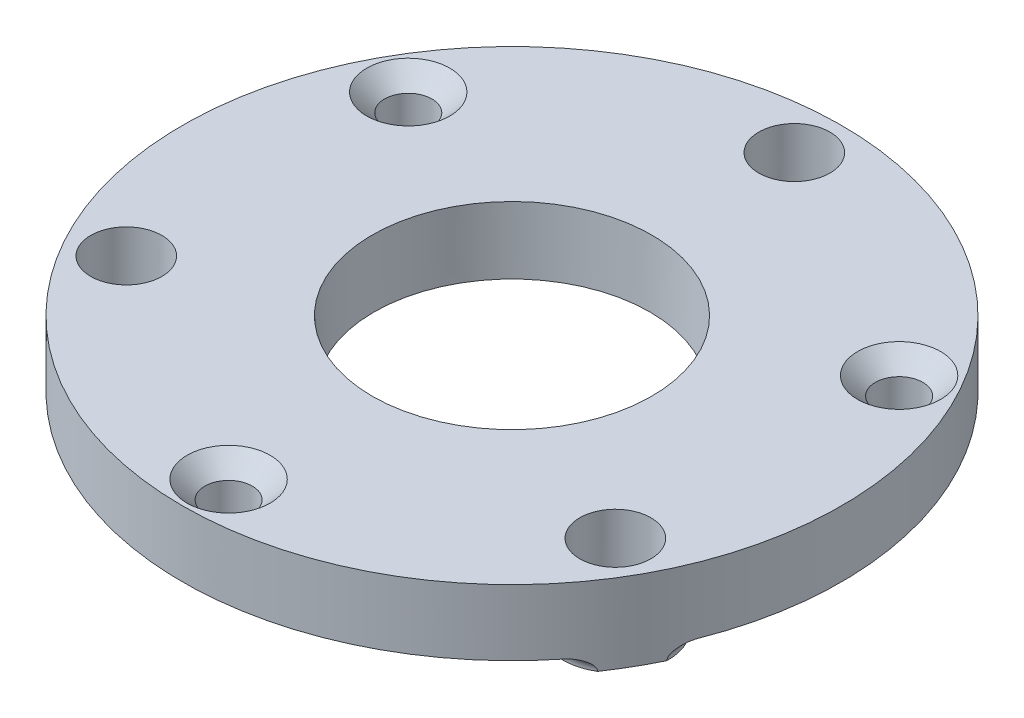
from build123d import *
from build123d.topology import SkipClean

# Parameters (mm, degrees)
CROQUIS1_R                                           = 25
SALIENTE_EXTRUIR1_DEPTH                              = 5
CROQUIS2_R                                           = 2.7
CORTAR_EXTRUIR2_DEPTH                                = 5
CROQUIS3_R                                           = 1.45
CORTAR_EXTRUIR3_DEPTH                                = 5
CROQUIS4_R                                           = 10.6
CORTAR_EXTRUIR4_DEPTH                                = 5
CORTAR_EXTRUIR4_DRAFT                                = -1.5
AVELLANADO_PARA_TORNILLO_CON_CABEZA_PLAN_D           = 3.6
AVELLANADO_PARA_TORNILLO_CON_CABEZA_PLAN_CSINK_D     = 6.3
AVELLANADO_PARA_TORNILLO_CON_CABEZA_PLAN_CSINK_ANGLE = 90
CROQUIS7_R                                           = 2.7
SALIENTE_EXTRUIR2_DEPTH                              = 1
REDONDEO1_R                                          = 1


with BuildPart() as part:
    # Croquis1 → Saliente-Extruir1 (new body)
    with BuildSketch(Plane(origin=(0, 0, 0), x_dir=(1, 0, 0), z_dir=(0, 1, 0))):
        with Locations(Location((0, 0, 0), (0, 0, 270))):
            Circle(CROQUIS1_R)
    extrude(amount=SALIENTE_EXTRUIR1_DEPTH)

    # Croquis2 → Cortar-Extruir2 (cut)
    with BuildSketch(Plane(origin=(0, 5, 0), x_dir=(1, 0, 0), z_dir=(0, 1, 0))):
        with Locations(Location((0, 21.42, 0), (0, 0, 270))):
            Circle(CROQUIS2_R)
        with Locations(Location((18.550264149, -10.71, 0), (0, 0, 270))):
            Circle(CROQUIS2_R)
        with Locations(Location((-18.550264149, -10.71, 0), (0, 0, 270))):
            Circle(CROQUIS2_R)
    extrude(amount=-CORTAR_EXTRUIR2_DEPTH, mode=Mode.SUBTRACT)

    # Croquis3 → Cortar-Extruir3 (cut)
    with BuildSketch(Plane(origin=(0, 5, 0), x_dir=(1, 0, 0), z_dir=(0, 1, 0))):
        with Locations(Location((0, -21.5, 0), (0, 0, 270))):
            Circle(CROQUIS3_R)
        with Locations(Location((-18.619546181, 10.75, 0), (0, 0, 270))):
            Circle(CROQUIS3_R)
        with Locations(Location((18.619546181, 10.75, 0), (0, 0, 270))):
            Circle(CROQUIS3_R)
    extrude(amount=-CORTAR_EXTRUIR3_DEPTH, mode=Mode.SUBTRACT)


with BuildPart() as cortar_extruir4_tool:
    # Croquis4 → Cortar-Extruir4 (with draft: the straight prism first)
    with BuildSketch(Plane(origin=(0, 5, 0), x_dir=(1, 0, 0), z_dir=(0, 1, 0))):
        Circle(CROQUIS4_R)
    extrude(amount=-CORTAR_EXTRUIR4_DEPTH)
    # Cortar-Extruir4: the draft: its side faces are tilted about the plane it starts from
    cortar_extruir4_sides = [cortar_extruir4_tool.faces().sort_by_distance(p)[0] for p in [
        (-10.6, 2.5, 0),
    ]]
    draft(cortar_extruir4_sides, Plane(origin=(0, 5, 0), x_dir=(1, 0, 0), z_dir=(0, 1, 0)), CORTAR_EXTRUIR4_DRAFT)


with BuildPart() as part_1:
    add(part.part)

    # Cortar-Extruir4: cut by cortar_extruir4_tool
    add(cortar_extruir4_tool.part, mode=Mode.SUBTRACT)

    # Avellanado para tornillo con cabeza plana de M31 (through all)
    with Locations(Plane(origin=(0, 5, 0), x_dir=(1, 0, 0), z_dir=(0, 1, 0))):
        with Locations((-18.619546181, 10.75), (18.619546181, 10.75), (0, -21.5)):
            CounterSinkHole(AVELLANADO_PARA_TORNILLO_CON_CABEZA_PLAN_D / 2, AVELLANADO_PARA_TORNILLO_CON_CABEZA_PLAN_CSINK_D / 2, counter_sink_angle=AVELLANADO_PARA_TORNILLO_CON_CABEZA_PLAN_CSINK_ANGLE)

    # Croquis7 → Saliente-Extruir2 (add)
    # profile 1 of 3: a face of its own
    with SkipClean():  # the faces are left unmerged after this step: merging them gives an invalid solid
        with BuildSketch(Plane(origin=(0, 0, 0), x_dir=(-1, 0, 0), z_dir=(0, -1, 0))):
            with BuildLine():
                ThreePointArc((22.549366787, -10.794723595), (15.086162534, -8.71), (20.623188254, -14.13096268))
                ThreePointArc((20.623188254, -14.13096268), (21.650635095, -12.5), (22.549366787, -10.794723595))
            make_face()
            with Locations(Location((18.550264149, -10.71, 0), (0, 0, 270))):
                Circle(CROQUIS7_R, mode=Mode.SUBTRACT)
        # profile 2 of 3: a face of its own
        with BuildSketch(Plane(origin=(0, 0, 0), x_dir=(-1, 0, 0), z_dir=(0, -1, 0))):
            with BuildLine():
                ThreePointArc((-20.623188254, -14.13096268), (-15.086162534, -8.71), (-22.549366787, -10.794723595))
                ThreePointArc((-22.549366787, -10.794723595), (-21.650635095, -12.5), (-20.623188254, -14.13096268))
            make_face()
            with Locations(Location((-18.550264149, -10.71, 0), (0, 0, 270))):
                Circle(CROQUIS7_R, mode=Mode.SUBTRACT)
        # profile 3 of 3: a face of its own
        with BuildSketch(Plane(origin=(0, 0, 0), x_dir=(-1, 0, 0), z_dir=(0, -1, 0))):
            with BuildLine():
                ThreePointArc((-1.926178534, 24.925686275), (0, 17.42), (1.926178534, 24.925686275))
                ThreePointArc((1.926178534, 24.925686275), (0, 25), (-1.926178534, 24.925686275))
            make_face()
            with Locations(Location((0, 21.42, 0), (0, 0, 270))):
                Circle(CROQUIS7_R, mode=Mode.SUBTRACT)
        extrude(amount=SALIENTE_EXTRUIR2_DEPTH)

    # Redondeo1
    # the kernel refuses this fillet: 1 mm, written as the material it adds along each edge
    with BuildSketch(Plane(origin=(0, 0, -21.42), x_dir=(0.0031415874858800596, 0, -0.9999950652018583), z_dir=(-0.9999950652018583, 0, -0.0031415874858800596))) as redondeo1_piece_1_section:
        with BuildLine():
            CenterArc((4 + REDONDEO1_R, REDONDEO1_R), REDONDEO1_R, 180, 90)
            Line((4, REDONDEO1_R), (4, 0))
            Line((4, 0), (4 + REDONDEO1_R, 0))
        make_face()
    redondeo1_piece_1 = revolve(axis=Axis((0, 0, -21.42), (0, -1, 0)), revolution_arc=359.64, mode=Mode.PRIVATE)
    redondeo1_piece_1 = redondeo1_piece_1 & Plane(origin=(0, -0.280437839, 0), x_dir=(0, 0, 1), z_dir=(0, -1, 0)) * Cylinder(25, 21, mode=Mode.PRIVATE)
    add(redondeo1_piece_1)
    with BuildSketch(Plane(origin=(18.550264149, 0, 10.71), x_dir=(0.8644503363809782, 0, 0.5027182271718559), z_dir=(0.5027182271718559, 0, -0.8644503363809782))) as redondeo1_piece_2_section:
        with BuildLine():
            CenterArc((4 + REDONDEO1_R, REDONDEO1_R), REDONDEO1_R, 180, 90)
            Line((4, REDONDEO1_R), (4, 0))
            Line((4, 0), (4 + REDONDEO1_R, 0))
        make_face()
    redondeo1_piece_2 = revolve(axis=Axis((18.550264149, 0, 10.71), (0, -1, 0)), revolution_arc=359.64, mode=Mode.PRIVATE)
    redondeo1_piece_2 = redondeo1_piece_2 & Plane(origin=(0, -0.280437839, 0), x_dir=(0, 0, 1), z_dir=(0, -1, 0)) * Cylinder(25, 21, mode=Mode.PRIVATE)
    add(redondeo1_piece_2)
    with BuildSketch(Plane(origin=(-18.550264149, 0, 10.71), x_dir=(-0.867591923866794, 0, 0.49727683803000045), z_dir=(0.49727683803000045, 0, 0.867591923866794))) as redondeo1_piece_3_section:
        with BuildLine():
            CenterArc((4 + REDONDEO1_R, REDONDEO1_R), REDONDEO1_R, 180, 90)
            Line((4, REDONDEO1_R), (4, 0))
            Line((4, 0), (4 + REDONDEO1_R, 0))
        make_face()
    redondeo1_piece_3 = revolve(axis=Axis((-18.550264149, 0, 10.71), (0, -1, 0)), revolution_arc=359.64, mode=Mode.PRIVATE)
    redondeo1_piece_3 = redondeo1_piece_3 & Plane(origin=(0, -0.280437839, 0), x_dir=(0, 0, 1), z_dir=(0, -1, 0)) * Cylinder(25, 20, mode=Mode.PRIVATE)
    add(redondeo1_piece_3)


solid = part_1.part
